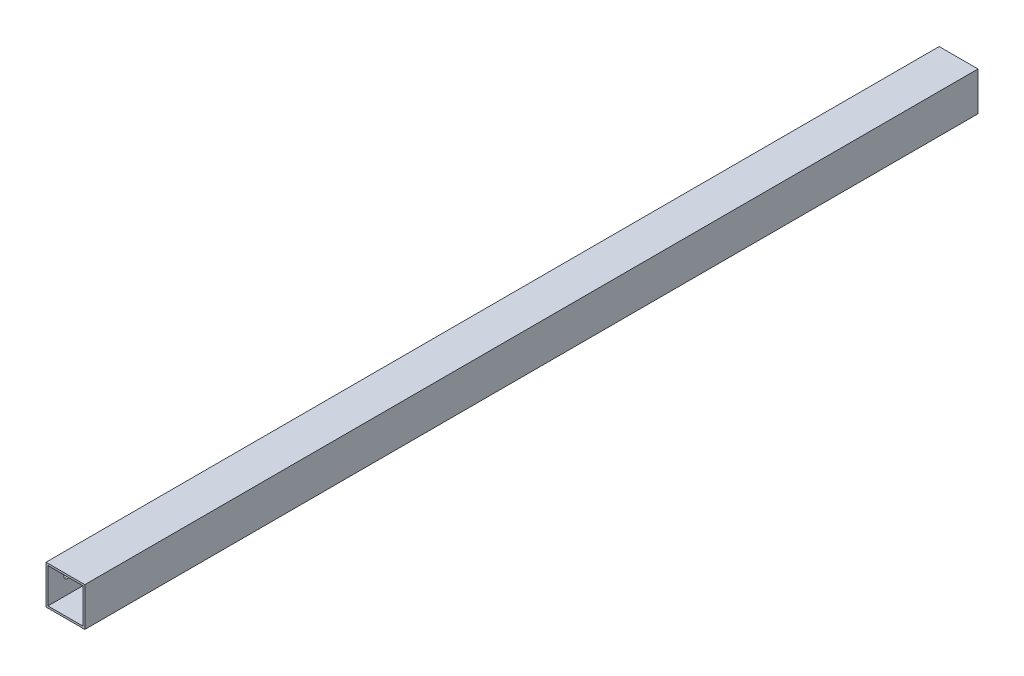
from build123d import *

# Parameters (mm, degrees)
SKETCH_1_W          = 20
SKETCH_1_H          = 20
SKETCH_1_W_2        = 18
SKETCH_1_H_2        = 18
EXTRUDE_1_DEPTH     = 460
SKETCH_2_R          = 1.8
CUT_EXTRUDE_1_DEPTH = 3
SKETCH_3_R          = 1.8
CUT_EXTRUDE_2_DEPTH = 3
SKETCH_5_R          = 1.8
CUT_EXTRUDE_3_DEPTH = 3
SKETCH_6_R          = 1.8
CUT_EXTRUDE_4_DEPTH = 10


with BuildPart() as part:
    # 草图1 → 凸台-拉伸1 (new body)
    with BuildSketch(Plane.XY):
        Rectangle(SKETCH_1_W, SKETCH_1_H)
        Rectangle(SKETCH_1_W_2, SKETCH_1_H_2, mode=Mode.SUBTRACT)
    extrude(amount=EXTRUDE_1_DEPTH)

    # 草图2 → 切除-拉伸1 (cut)
    with BuildSketch(Plane.ZY.offset(10)):
        with Locations((10, 0)):
            Circle(SKETCH_2_R)
    extrude(amount=-CUT_EXTRUDE_1_DEPTH, mode=Mode.SUBTRACT)

    # 草图3 → 切除-拉伸2 (cut)
    with BuildSketch(Plane.ZY.offset(10)):
        with Locations((198, 0)):
            Circle(SKETCH_3_R)
    extrude(amount=-CUT_EXTRUDE_2_DEPTH, mode=Mode.SUBTRACT)

    # 草图5 → 切除-拉伸3 (cut)
    with BuildSketch(Plane.ZY.offset(10)):
        with Locations((450, 0)):
            Circle(SKETCH_5_R)
    extrude(amount=-CUT_EXTRUDE_3_DEPTH, mode=Mode.SUBTRACT)

    # 草图6 → 切除-拉伸4 (cut)
    with BuildSketch(Plane.ZY.offset(10)):
        with Locations((262, 0)):
            Circle(SKETCH_6_R)
    extrude(amount=-CUT_EXTRUDE_4_DEPTH, mode=Mode.SUBTRACT)


solid = part.part
